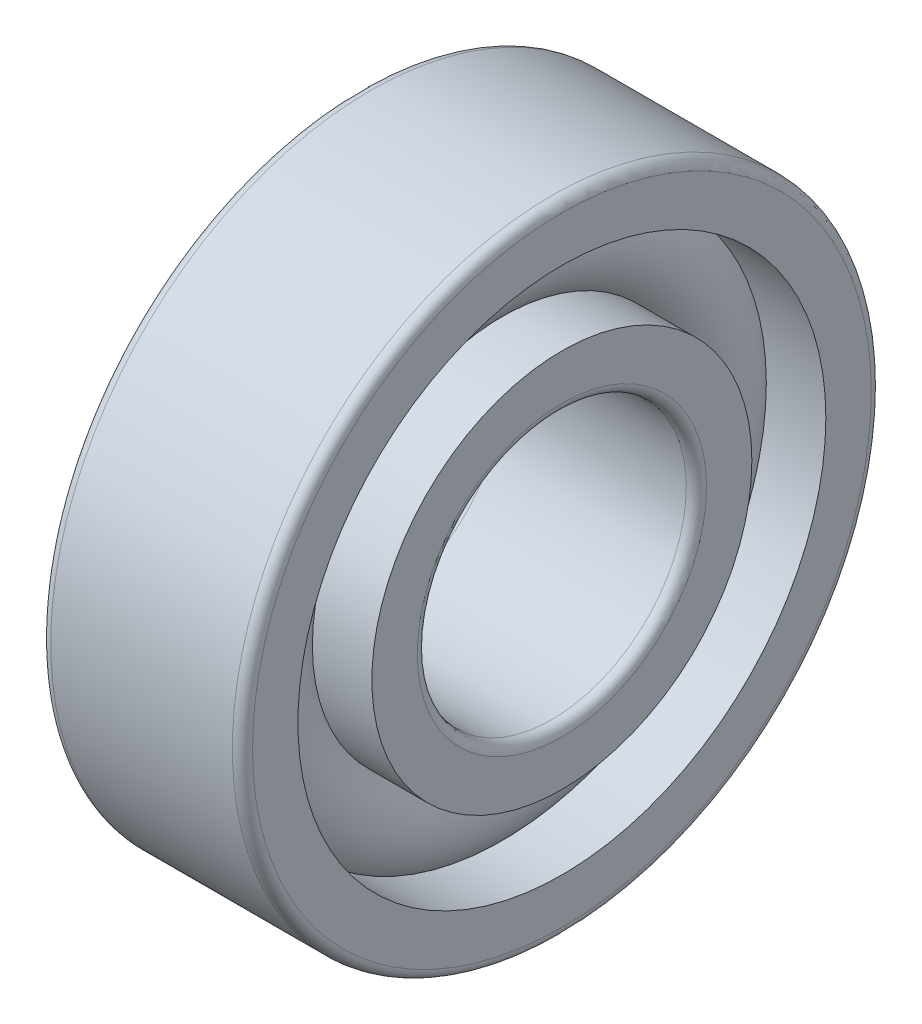
from build123d import *

# Parameters (mm, degrees)
CAGSPISKE_W     = 0.33
CAGSPISKE_H     = 0.55
CAGESPINE_ANGLE = 0.001
BALSIMSKE_R     = 1.65


with BuildPart() as part:
    # CagSpiSke → CageSpine (revolve)
    with BuildSketch(Plane.XY):
        with Locations((0, 6.75)):
            Rectangle(CAGSPISKE_W, CAGSPISKE_H)
    revolve(axis=Axis((-20.6375, 0, 0), (-1, 0, 0)), revolution_arc=CAGESPINE_ANGLE)

    # BalSimSke → BallsSimplified (revolve)
    with BuildSketch(Plane.XY):
        with Locations((0, 6.75)):
            Circle(BALSIMSKE_R)
    revolve(axis=Axis((-10, 0, 0), (1, 0, 0)))

    # InnRacSke → InnerRace (revolve)
    with BuildSketch(Plane.XY):
        with BuildLine():
            Line((-1.196087371, 5.65), (-3, 5.65))
            Line((-3, 5.65), (-3, 4.3))
            ThreePointArc((-3, 4.3), (-2.912132034, 4.087867966), (-2.7, 4))
            Line((-2.7, 4), (2.7, 4))
            ThreePointArc((2.7, 4), (2.912132034, 4.087867966), (3, 4.3))
            Line((3, 4.3), (3, 5.65))
            Line((3, 5.65), (1.196087371, 5.65))
            ThreePointArc((1.196087371, 5.65), (0, 5.125), (-1.196087371, 5.65))
        make_face()
    revolve(axis=Axis((-20.6375, 0, 0), (1, 0, 0)))

    # OutRacSke → OuterRace (revolve)
    with BuildSketch(Plane.XY):
        with BuildLine():
            Line((-1.196087371, 7.85), (-3, 7.85))
            Line((-3, 7.85), (-3, 9.2))
            ThreePointArc((-3, 9.2), (-2.912132034, 9.412132034), (-2.7, 9.5))
            Line((-2.7, 9.5), (2.7, 9.5))
            ThreePointArc((2.7, 9.5), (2.912132034, 9.412132034), (3, 9.2))
            Line((3, 9.2), (3, 7.85))
            Line((3, 7.85), (1.196087371, 7.85))
            ThreePointArc((1.196087371, 7.85), (0, 8.375), (-1.196087371, 7.85))
        make_face()
    revolve(axis=Axis((-20.6375, 0, 0), (1, 0, 0)))


solid = part.part
